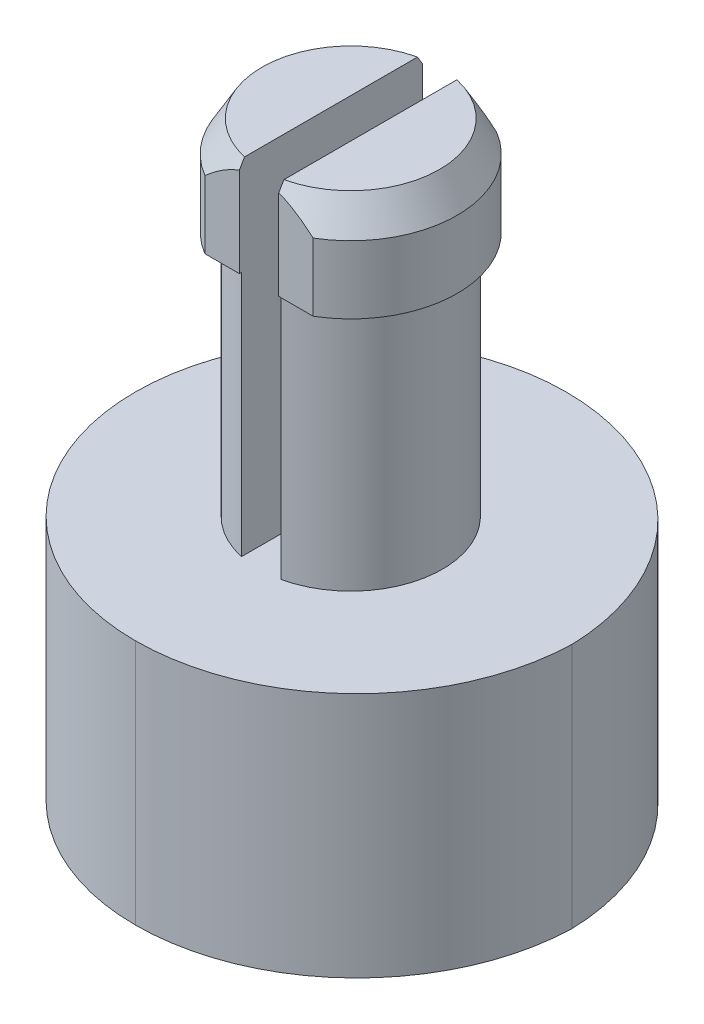
from build123d import *
from OCP.BRepFilletAPI import BRepFilletAPI_MakeChamfer

# Parameters (mm, degrees)
BOSS_EXTRUDE1_DEPTH = 11.1125
FILLET1_R           = 6.35
FILLET2_R           = 5.715
SKETCH2_R           = 2.365
BOSS_EXTRUDE2_DEPTH = 6.35
BOSS_EXTRUDE3_DEPTH = 2.54
SKETCH4_W           = 1.016
SKETCH4_H           = 8.89
CUT_EXTRUDE2_DEPTH  = 21.94269975
CHAMFER1_SIZE       = 0.79375
CHAMFER1_SIZE2      = 0.458271776
CUT_EXTRUDE3_DEPTH  = 21.94269975


# Some blends are built 0.0001 mm under size
with BuildPart() as part:
    # Sketch1 → Boss-Extrude1 (new body)
    with BuildSketch(Plane.XY):
        with BuildLine():
            Line((3.302, 0), (15.367, 0))
            Line((15.367, 0), (15.367, -6.35))
            Line((15.367, -6.35), (-6.477, -6.35))
            Line((-6.477, -6.35), (-6.477, 0))
            Line((-6.477, 0), (-3.302, 0))
            ThreePointArc((-3.302, 0), (0, -3.302), (3.302, 0))
        make_face()
    extrude(amount=BOSS_EXTRUDE1_DEPTH)

    # Fillet1
    fillet1_edges = [part.edges().sort_by_distance(p)[0] for p in [
        (-6.477, -6.35, 5.55625),
    ]]
    fillet(fillet1_edges, radius=FILLET1_R - 0.0001)  # a hair under: the kernel refuses the full size

    # Fillet2
    # the kernel refuses this fillet: 5.715 mm, written as the material it takes off along each edge
    with BuildSketch(Plane(origin=(15.367, 14.2875, 0), x_dir=(-1, 0, 0), z_dir=(0, -1, 0)), Plane(origin=(15.367, 14.2875, 11.1125), x_dir=(0, 0, -1), z_dir=(0, -1, 0))) as fillet2_piece_1:
        with BuildLine():
            CenterArc((FILLET2_R, -FILLET2_R), FILLET2_R, 90, 90)
            Line((0, -FILLET2_R), (0, 0))
            Line((0, 0), (FILLET2_R, 0))
        make_face()
    extrude(amount=34.925, mode=Mode.SUBTRACT)

    # Sketch2 → Boss-Extrude2 (add)
    with BuildSketch(Plane(origin=(0, 0, 0), x_dir=(1, 0, 0), z_dir=(0, 1, 0))):
        with Locations(Location((9.652, -5.55625, 0), (0, 0, 270))):
            Circle(SKETCH2_R)
    extrude(amount=BOSS_EXTRUDE2_DEPTH)

    # Sketch3 → Boss-Extrude3 (add)
    with BuildSketch(Plane(origin=(0, 6.35, 0), x_dir=(1, 0, 0), z_dir=(0, 1, 0))):
        with BuildLine():
            Line((8.25654631, -7.92125), (11.04745369, -7.92125))
            ThreePointArc((11.04745369, -7.92125), (12.398, -5.55625), (11.04745369, -3.19125))
            Line((11.04745369, -3.19125), (8.25654631, -3.19125))
            ThreePointArc((8.25654631, -3.19125), (6.906, -5.55625), (8.25654631, -7.92125))
        make_face()
    extrude(amount=BOSS_EXTRUDE3_DEPTH)

    # Sketch4 → Cut-Extrude2 (cut, through all)
    with BuildSketch(Plane.XY):
        with Locations((9.652, 4.445)):
            Rectangle(SKETCH4_W, SKETCH4_H)
    extrude(amount=CUT_EXTRUDE2_DEPTH, mode=Mode.SUBTRACT)

    # Chamfer1: one chamfer whose edges measure the first distance from different faces: ONE call of the kernel's chamfer builder (chamfer() names one face for all edges)
    chamfer1_edges_1 = [part.edges().sort_by_distance(p)[0] for p in [
        (6.906, 8.89, 5.55625),
    ]]
    chamfer1_side_1 = [part.faces().sort_by_distance(p)[0] for p in [
        (6.906, 7.62, 5.55625),
    ]]
    chamfer1_edges_2 = [part.edges().sort_by_distance(p)[0] for p in [
        (12.398, 8.89, 5.55625),
    ]]
    chamfer1_side_2 = [part.faces().sort_by_distance(p)[0] for p in [
        (12.398, 7.62, 5.55625),
    ]]
    chamfer1 = BRepFilletAPI_MakeChamfer(part.part.solid().wrapped)
    for e in chamfer1_edges_1:
        chamfer1.Add(CHAMFER1_SIZE, CHAMFER1_SIZE2, e.wrapped, chamfer1_side_1[0].wrapped)  # the first distance lies on this face
    for e in chamfer1_edges_2:
        chamfer1.Add(CHAMFER1_SIZE, CHAMFER1_SIZE2, e.wrapped, chamfer1_side_2[0].wrapped)  # the first distance lies on this face
    add(Compound.cast(chamfer1.Shape()), mode=Mode.REPLACE)

    # Sketch5 → Cut-Extrude3 (cut, through all)
    with BuildSketch(Plane(origin=(0, 0, 0), x_dir=(1, 0, 0), z_dir=(0, 1, 0))):
        with BuildLine():
            Line((9.652, 0), (-6.477, 0))
            Line((-6.477, 0), (-6.477, -11.1125))
            Line((-6.477, -11.1125), (9.652, -11.1125))
            ThreePointArc((9.652, -11.1125), (4.09575, -5.55625), (9.652, 0))
        make_face()
    extrude(amount=-CUT_EXTRUDE3_DEPTH, mode=Mode.SUBTRACT)


solid = part.part
